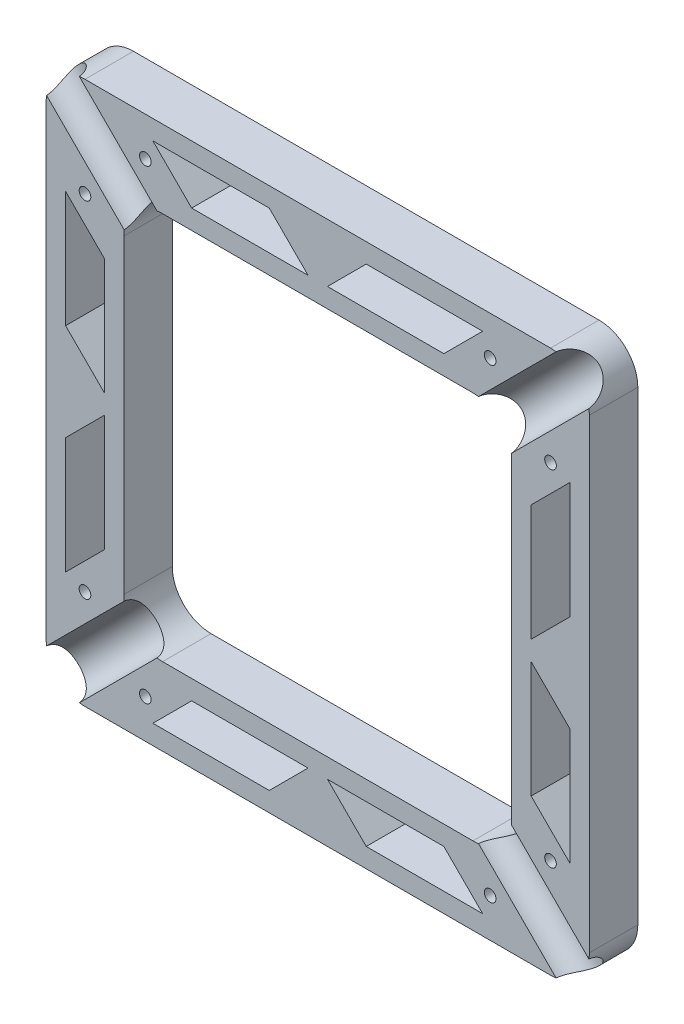
from build123d import *

# Parameters (mm, degrees)
ESQUISSE1_W                  = 140
ESQUISSE1_H                  = 140
ESQUISSE1_W_2                = 100
ESQUISSE1_H_2                = 100
BOSS_EXTRU_1_DEPTH           = 12.5
ENL_V_MAT_EXTRU_1_DEPTH      = 100
R_P_TITION_CIRCULAIRE1_COUNT = 2
R_P_TITION_CIRCULAIRE1_ANGLE = 90
CONG_1_R                     = 10
ESQUISSE3_R                  = 1.5
ENL_V_MAT_EXTRU_2_DEPTH      = 13


with BuildPart() as part:
    # Esquisse1 → Boss.-Extru.1 (new body)
    with BuildSketch(Plane.XY):
        Rectangle(ESQUISSE1_W, ESQUISSE1_H)
        Rectangle(ESQUISSE1_W_2, ESQUISSE1_H_2, mode=Mode.SUBTRACT)
        Polygon((65, 12.5), (55, 2.5), (55, 32.5), (65, 42.5), align=None, mode=Mode.SUBTRACT)
        Polygon((65, -12.5), (55, -2.5), (55, -32.5), (65, -42.5), align=None, mode=Mode.SUBTRACT)
        Polygon((12.5, -65), (2.5, -55), (32.5, -55), (42.5, -65), align=None, mode=Mode.SUBTRACT)
        Polygon((-12.5, -65), (-2.5, -55), (-32.5, -55), (-42.5, -65), align=None, mode=Mode.SUBTRACT)
        Polygon((-65, -12.5), (-55, -2.5), (-55, -32.5), (-65, -42.5), align=None, mode=Mode.SUBTRACT)
        Polygon((-65, 12.5), (-55, 2.5), (-55, 32.5), (-65, 42.5), align=None, mode=Mode.SUBTRACT)
        Polygon((-12.5, 65), (-2.5, 55), (-32.5, 55), (-42.5, 65), align=None, mode=Mode.SUBTRACT)
        Polygon((12.5, 65), (2.5, 55), (32.5, 55), (42.5, 65), align=None, mode=Mode.SUBTRACT)
    extrude(amount=BOSS_EXTRU_1_DEPTH)

    # Esquisse2 → Enlèv. mat.-Extru.1 (cut, symmetric)
    with BuildSketch(Plane(origin=(0, 0, 0), x_dir=(-0.7071067811865475, -0.7071067811865477, 0), z_dir=(-0.7071067811865477, 0.7071067811865475, 0))):
        with BuildLine():
            Line((-6, 13), (6, 13))
            ThreePointArc((6, 13), (0, 7), (-6, 13))
        make_face()
    enl_v_mat_extru_1 = extrude(amount=ENL_V_MAT_EXTRU_1_DEPTH, both=True, mode=Mode.SUBTRACT)

    # Répétition circulaire1: Enlèv. mat.-Extru.1 ×2 about axis
    r_p_tition_circulaire1_axis = Axis((0, 0, -62.841973852), (0, 0, 1))
    for i in range(1, R_P_TITION_CIRCULAIRE1_COUNT):
        add(enl_v_mat_extru_1.rotate(r_p_tition_circulaire1_axis, i * R_P_TITION_CIRCULAIRE1_ANGLE / (R_P_TITION_CIRCULAIRE1_COUNT - 1)), mode=Mode.SUBTRACT)

    # Congé1
    cong_1_edges = [part.edges().sort_by_distance(p)[0] for p in [
        (-50, -50, 3.5),
        (50, -50, 3.5),
        (50, 50, 3.5),
        (-50, 50, 3.5),
    ]]
    fillet(cong_1_edges, radius=CONG_1_R)
    cong_1_2_edges = [part.edges().sort_by_distance(p)[0] for p in [
        (-70, 70, 3.5),
        (-70, -70, 3.5),
        (70, 70, 3.5),
        (70, -70, 3.5),
    ]]
    fillet(cong_1_2_edges, radius=CONG_1_R)

    # Esquisse3 → Enlèv. mat.-Extru.2 (cut)
    with BuildSketch(Plane.XY.offset(12.5)):
        with Locations((-60, -44.443650814)):
            Circle(ESQUISSE3_R)
        with Locations((-44.443650814, -60)):
            Circle(ESQUISSE3_R)
        with Locations((-44.443650814, 60)):
            Circle(ESQUISSE3_R)
        with Locations((-60, 44.443650814)):
            Circle(ESQUISSE3_R)
        with Locations((60, 44.443650814)):
            Circle(ESQUISSE3_R)
        with Locations((44.443650814, 60)):
            Circle(ESQUISSE3_R)
        with Locations((44.443650814, -60)):
            Circle(ESQUISSE3_R)
        with Locations((60, -44.443650814)):
            Circle(ESQUISSE3_R)
    extrude(amount=-ENL_V_MAT_EXTRU_2_DEPTH, mode=Mode.SUBTRACT)


solid = part.part
